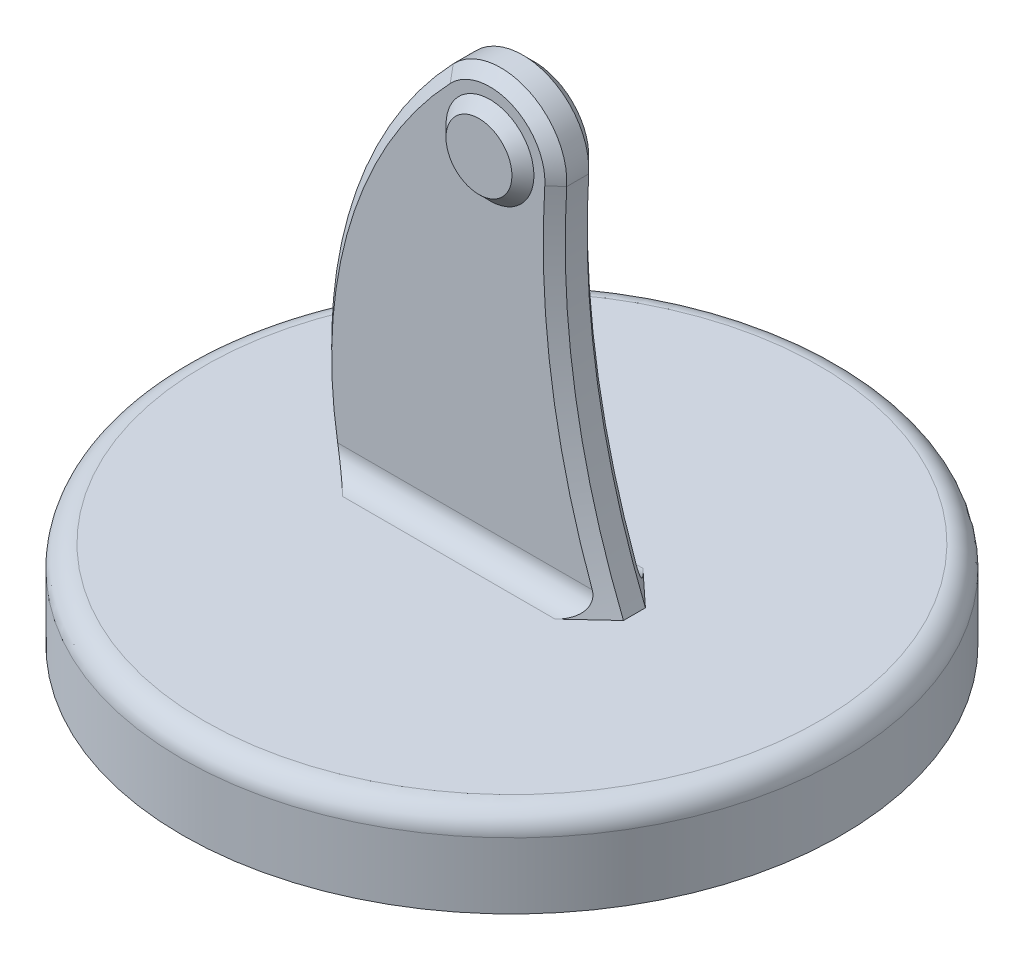
from build123d import *

# Parameters (mm, degrees)
SKETCH2_R           = 75
BOSS_EXTRUDE1_DEPTH = 20
FILLET1_R           = 5
BOSS_EXTRUDE2_DEPTH = 5
CHAMFER4_SIZE       = 2.5
FILLET2_R           = 5
SKETCH7_R           = 10
BOSS_EXTRUDE3_DEPTH = 2.5
CHAMFER5_SIZE       = 2.5
SKETCH8_R           = 5
CUT_EXTRUDE1_DEPTH  = 10


with BuildPart() as part:
    # Sketch2 → Boss-Extrude1 (new body)
    with BuildSketch(Plane(origin=(0, 0, 0), x_dir=(1, 0, 0), z_dir=(0, 1, 0))):
        with Locations(Location((0, 0, 0), (0, 0, 270))):
            Circle(SKETCH2_R)
    extrude(amount=BOSS_EXTRUDE1_DEPTH)

    # Fillet1
    fillet1_edges = [part.edges().sort_by_distance(p)[0] for p in [
        (0, 20, -75),
    ]]
    fillet(fillet1_edges, radius=FILLET1_R)

    # Sketch3 → Boss-Extrude2 (add, symmetric)
    with BuildSketch(Plane.XY):
        with BuildLine():
            Line((-35, 15), (30, 15))
            ThreePointArc((30, 15), (17.428098582, 56.126843631), (14.970645506, 99.06203778))
            ThreePointArc((14.970645506, 99.06203778), (6.012327577, 113.742340307), (-10.849201429, 110.358321696))
            ThreePointArc((-10.849201429, 110.358321696), (-35.460543036, 65.854059614), (-35, 15))
        make_face()
    extrude(amount=BOSS_EXTRUDE2_DEPTH, both=True)

    # Chamfer4
    chamfer4_edges = [part.edges().sort_by_distance(p)[0] for p in [
        (-34.796467261, 68.341174934, -5),
        (16.970295051, 58.803839559, -5),
        (6.012327577, 113.742340307, -5),
        (16.970295051, 58.803839559, 5),
        (6.012327577, 113.742340307, 5),
        (-34.796467261, 68.341174934, 5),
    ]]
    chamfer(chamfer4_edges, length=CHAMFER4_SIZE)

    # Fillet2
    fillet2_edges = [part.edges().sort_by_distance(p)[0] for p in [
        (-4.241511046, 20, 5),
        (-4.241511046, 20, -5),
    ]]
    fillet(fillet2_edges, radius=FILLET2_R)

    # Sketch7 → Boss-Extrude3 (add, symmetric)
    with BuildSketch(Plane.XY.offset(5)):
        with Locations(Location((0, 100, 0), (0, 0, 180))):
            Circle(SKETCH7_R)
    extrude(amount=BOSS_EXTRUDE3_DEPTH, both=True)

    # Chamfer5
    chamfer5_edges = [part.edges().sort_by_distance(p)[0] for p in [
        (10, 100, 7.5),
    ]]
    chamfer(chamfer5_edges, length=CHAMFER5_SIZE - 0.0001)  # a hair under: the kernel refuses the full size

    # Sketch8 → Cut-Extrude1 (cut)
    with BuildSketch(Plane(origin=(0, 0, -5), x_dir=(-1, 0, 0), z_dir=(0, 0, -1))):
        with Locations((0, 100)):
            Circle(SKETCH8_R)
    extrude(amount=-CUT_EXTRUDE1_DEPTH, mode=Mode.SUBTRACT)


solid = part.part
